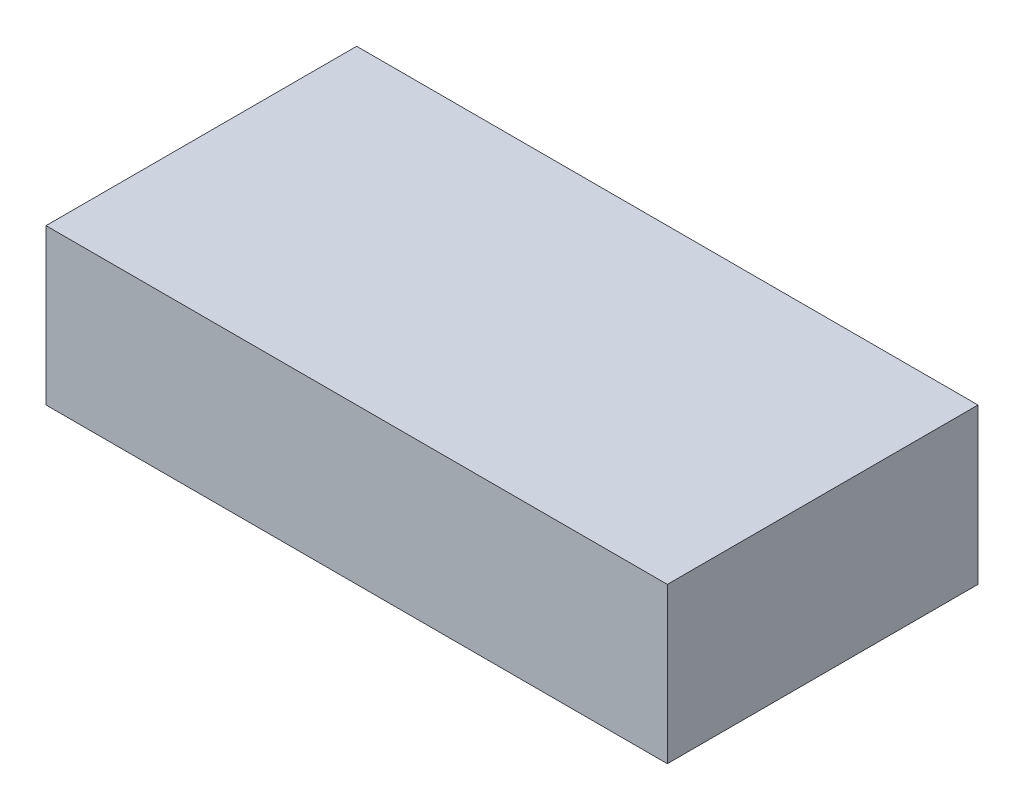
from build123d import *

# Parameters (mm, degrees)
SKETCH1_W                      = 101.6
SKETCH1_H                      = 50.8
BOSS_EXTRUDE1_DEPTH            = 25.4
CUT_EXTRUDE1_START             = -8.382
CUT_EXTRUDE1_DEPTH             = 19.05
CUT_EXTRUDE2_REACH             = 131.097
CUT_EXTRUDE2_START             = -12.7
SKETCH5_W                      = 40.447236645
SKETCH5_H                      = 19.05
CUT_EXTRUDE2_DIRECTION_2_REACH = 131.097


with BuildPart() as part:
    # Sketch1 → Boss-Extrude1 (new body)
    with BuildSketch(Plane(origin=(0, 0, 0), x_dir=(1, 0, 0), z_dir=(0, 1, 0))):
        with Locations((50.8, 25.4)):
            Rectangle(SKETCH1_W, SKETCH1_H)
    extrude(amount=BOSS_EXTRUDE1_DEPTH)

    # Sketch3 → Cut-Extrude1 (cut)
    with BuildSketch(Plane(origin=(0, 0, -50.8), x_dir=(-1, 0, 0), z_dir=(0, 0, -1)).offset(CUT_EXTRUDE1_START)):
        with BuildLine():
            Line((-22.273301809, 1.359748429), (-9.63710462, 1.683896095))
            add(Edge.make_bspline(
                [(-9.63710462, 1.683896095), (-9.432624425, 1.689141484), (-9.22096582, 1.750596425), (-8.894469721, 1.915822106), (-8.784838362, 1.983288458), (-8.57026337, 2.139552524), (-8.464521417, 2.228696962), (-8.257979388, 2.431294287), (-8.156724105, 2.545534393), (-7.969570673, 2.795070024), (-7.882733344, 2.930935471), (-7.729462763, 3.232047749), (-7.665732488, 3.392172612), (-7.574034219, 3.735651999), (-7.547397909, 3.916826761), (-7.545197482, 4.100535433)],
                knots=[0, 0, 0, 0, 0.25, 0.25, 0.375, 0.375, 0.5, 0.5, 0.625, 0.625, 0.75, 0.75, 0.875, 0.875, 1, 1, 1, 1], degree=3))
            add(Edge.make_bspline(
                [(-7.372668049, 18.435273853), (-7.458894266, 11.305795474), (-7.545197482, 4.100535433)],
                knots=[3.859840059, 3.859840059, 3.859840059, 3.869167356, 3.869167356, 3.869167356], degree=2, weights=[1, 0.999989125, 1]))
            add(Edge.make_bspline(
                [(-7.372668049, 18.435273853), (-7.370469536, 18.617054453), (-7.392134018, 18.79297643), (-7.477246214, 19.134361541), (-7.539697043, 19.294710354), (-7.689928733, 19.58938756), (-7.777880895, 19.72416159), (-7.965139109, 19.965181436), (-8.0657999, 20.073454445), (-8.379921722, 20.36362936), (-8.596990647, 20.505641882), (-9.035036301, 20.700850854), (-9.249635314, 20.750102389), (-9.454663887, 20.744842932)],
                knots=[0, 0, 0, 0, 0.125, 0.125, 0.25, 0.25, 0.375, 0.375, 0.5, 0.5, 0.75, 0.75, 1, 1, 1, 1], degree=3))
            Line((-9.454663887, 20.744842932), (-26.886426964, 20.297677916))
            add(Edge.make_bspline(
                [(-31.032285954, 19.91013022), (-30.666089985, 19.919523993), (-30.30462222, 19.942276801), (-29.590209461, 20.007399829), (-29.237253018, 20.049650029), (-28.538628851, 20.138633086), (-28.194871924, 20.185013416), (-27.528063682, 20.260241547), (-27.203300958, 20.289549366), (-26.886426964, 20.297677916)],
                knots=[0, 0, 0, 0, 0.25, 0.25, 0.5, 0.5, 0.75, 0.75, 1, 1, 1, 1], degree=3))
            Line((-31.032285954, 19.91013022), (-33.808331014, 19.838918248))
            ThreePointArc((-33.808331014, 19.838918248), (-35.748223078, 18.95353847), (-37.446365983, 17.663813987))
            ThreePointArc((-37.446365983, 17.663813987), (-40.444062505, 10.421759821), (-37.079002081, 3.342925078))
            ThreePointArc((-37.079002081, 3.342925078), (-35.316967286, 2.141962151), (-33.334232396, 1.357206822))
            Line((-33.334232396, 1.357206822), (-30.558187336, 1.428418795))
            add(Edge.make_bspline(
                [(-26.397911136, 1.253942666), (-27.032061099, 1.237675253), (-27.698925299, 1.301032414), (-28.752147456, 1.380673962), (-29.11039529, 1.405083278), (-29.829574793, 1.433638477), (-30.192245259, 1.437806055), (-30.558187336, 1.428418795)],
                knots=[0, 0, 0, 0, 0.5, 0.5, 0.75, 0.75, 1, 1, 1, 1], degree=3))
            Line((-26.397911136, 1.253942666), (-22.273301809, 1.359748429))
        make_face()
    extrude(amount=-CUT_EXTRUDE1_DEPTH, mode=Mode.SUBTRACT)

    # Cut-Extrude2: up to this plane
    cut_extrude2_end = Plane(origin=(0.049504862, 1.92984019, -23.368), z_dir=(0.02564387549125491, 0.9996711417510206, 0))
    # Sketch5 → Cut-Extrude2 (cut, up to the surface)
    with BuildSketch(Plane(origin=(0, 25.4, 0), x_dir=(1, 0, 0), z_dir=(0, 1, 0)).offset(CUT_EXTRUDE2_START), mode=Mode.PRIVATE) as cut_extrude2_sk1:
        with Locations((20.223618323, 32.893)):
            Rectangle(SKETCH5_W, SKETCH5_H)
    cut_extrude2_tool1 = split(extrude(cut_extrude2_sk1.sketch, amount=-CUT_EXTRUDE2_REACH, mode=Mode.PRIVATE), bisect_by=cut_extrude2_end, keep=Keep.BOTH, mode=Mode.PRIVATE)
    add(cut_extrude2_tool1.solids().sort_by_distance((20.223618, 12.7, -32.893))[0], mode=Mode.SUBTRACT)

    # Cut-Extrude2 direction 2: up to this plane
    cut_extrude2_direction_2_end = Plane(origin=(0.53802069, 20.97357544, -23.368), z_dir=(0.025643875491281238, 0.9996711417510199, 0))
    # Sketch5 → Cut-Extrude2 direction 2 (cut, up to the surface)
    with BuildSketch(Plane(origin=(0, 25.4, 0), x_dir=(1, 0, 0), z_dir=(0, 1, 0)).offset(CUT_EXTRUDE2_START), mode=Mode.PRIVATE) as cut_extrude2_direction_2_sk1:
        with Locations((20.223618323, 32.893)):
            Rectangle(SKETCH5_W, SKETCH5_H)
    cut_extrude2_direction_2_tool1 = split(extrude(cut_extrude2_direction_2_sk1.sketch, amount=CUT_EXTRUDE2_DIRECTION_2_REACH, mode=Mode.PRIVATE), bisect_by=cut_extrude2_direction_2_end, keep=Keep.BOTH, mode=Mode.PRIVATE)
    add(cut_extrude2_direction_2_tool1.solids().sort_by_distance((20.223618, 12.7, -32.893))[0], mode=Mode.SUBTRACT)


solid = part.part
